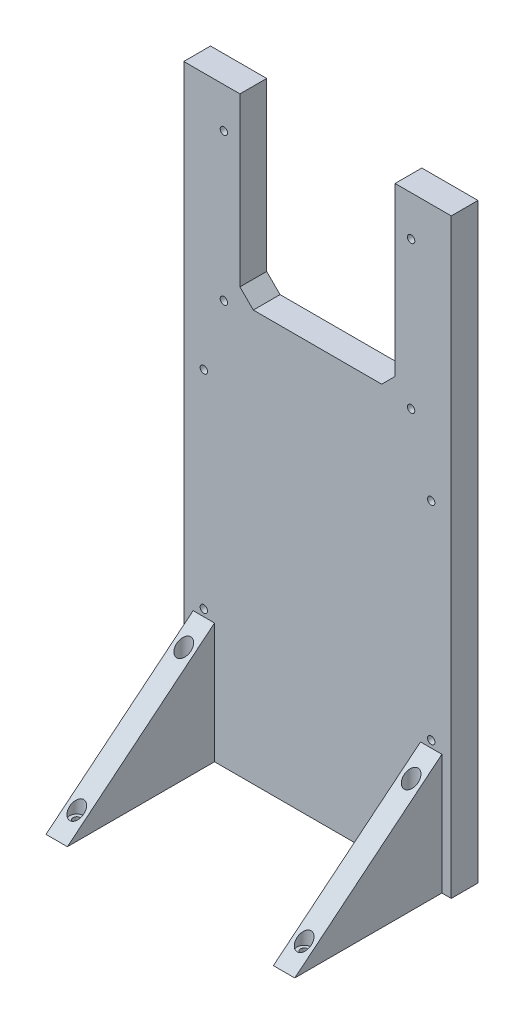
from build123d import *

# Parameters (mm, degrees)
SKETCH1_R           = 1.375
BOSS_EXTRUDE1_DEPTH = 10
CHAMFER1_SIZE       = 5
SKETCH2_W           = 8
SKETCH2_H           = 45
BOSS_EXTRUDE2_DEPTH = 55
SKETCH5_R           = 1.375
CUT_EXTRUDE2_DEPTH  = 186.151289491
SKETCH5_3_R         = 2.6
CUT_EXTRUDE3_DEPTH  = 52
SKETCH1_3_R         = 1.375
CUT_EXTRUDE4_DEPTH  = 10
CHAMFER3_SIZE       = 55.077249093
CHAMFER3_SIZE_2     = 45
SKETCH6_R           = 1.375
CUT_EXTRUDE5_DEPTH  = 10


with BuildPart() as part:
    # Sketch1 → Boss-Extrude1 (new body)
    with BuildSketch(Plane.XY):
        Polygon((-50, 110.5), (-50, -110.5), (50, -110.5), (50, 110.5), (29, 110.5), (29, 43.01), (-29, 43.01), (-29, 110.5), align=None)
        with BuildLine():
            ThreePointArc((-42.5, -64.375), (-43.875, -63), (-42.5, -61.625))
            ThreePointArc((-42.5, -61.625), (-41.125, -63), (-42.5, -64.375))
        make_face(mode=Mode.SUBTRACT)
        with Locations((42.5, -63)):
            Circle(SKETCH1_R, mode=Mode.SUBTRACT)
        with BuildLine():
            ThreePointArc((-42.5, 15.875), (-41.125, 14.5), (-42.5, 13.125))
            ThreePointArc((-42.5, 13.125), (-43.875, 14.5), (-42.5, 15.875))
        make_face(mode=Mode.SUBTRACT)
        with Locations((42.5, 14.5)):
            Circle(SKETCH1_R, mode=Mode.SUBTRACT)
    extrude(amount=BOSS_EXTRUDE1_DEPTH)

    # Chamfer1
    chamfer1_edges = [part.edges().sort_by_distance(p)[0] for p in [
        (29, 43.01, 5),
        (-29, 43.01, 5),
    ]]
    chamfer(chamfer1_edges, length=CHAMFER1_SIZE)

    # Sketch2 → Boss-Extrude2 (add)
    with BuildSketch(Plane.XY.offset(10)):
        with Locations((-42.5, -88)):
            Rectangle(SKETCH2_W, SKETCH2_H)
        with Locations((42.5, -88)):
            Rectangle(SKETCH2_W, SKETCH2_H)
    extrude(amount=BOSS_EXTRUDE2_DEPTH)

    # Sketch5 → Cut-Extrude2 (cut, through all)
    with BuildSketch(Plane(origin=(0, -55.5, 0), x_dir=(1, 0, 0), z_dir=(0, 1, 0))):
        with Locations(Location((-42.5, -17.5, 0), (0, 0, 270))):
            Circle(SKETCH5_R)
        with Locations(Location((-42.5, -57.5, 0), (0, 0, 270))):
            Circle(SKETCH5_R)
        with Locations(Location((42.5, -17.5, 0), (0, 0, 270))):
            Circle(SKETCH5_R)
        with Locations(Location((42.5, -57.5, 0), (0, 0, 270))):
            Circle(SKETCH5_R)
    extrude(amount=-CUT_EXTRUDE2_DEPTH, mode=Mode.SUBTRACT)

    # Sketch5<3> → Cut-Extrude3 (cut)
    with BuildSketch(Plane(origin=(0, -55.5, 0), x_dir=(1, 0, 0), z_dir=(0, 1, 0))):
        with Locations(Location((-42.5, -17.5, 0), (0, 0, 270))):
            Circle(SKETCH5_3_R)
        with Locations(Location((-42.5, -57.5, 0), (0, 0, 270))):
            Circle(SKETCH5_3_R)
        with Locations(Location((42.5, -17.5, 0), (0, 0, 180))):
            Circle(SKETCH5_3_R)
        with Locations(Location((42.5, -57.5, 0), (0, 0, 180))):
            Circle(SKETCH5_3_R)
    extrude(amount=-CUT_EXTRUDE3_DEPTH, mode=Mode.SUBTRACT)

    # Sketch1<3> → Cut-Extrude4 (cut)
    with BuildSketch(Plane.XY):
        with Locations((-42.5, -103)):
            Circle(SKETCH1_3_R)
        with Locations(Location((42.5, -103, 0), (0, 0, 180))):
            Circle(SKETCH1_3_R)
    extrude(amount=CUT_EXTRUDE4_DEPTH, mode=Mode.SUBTRACT)

    # Chamfer3
    # the kernel refuses this chamfer: 55.077249093, 45 mm, written as the material it takes off along each edge
    with BuildSketch(Plane(origin=(188.501029674, -65.5, 65), x_dir=(0, 0.02454043401221108, -0.9996988382000312), z_dir=(-1, 0, 0))) as chamfer3_piece_1_section:
        Polygon((CHAMFER3_SIZE * 0.9996988382, CHAMFER3_SIZE * 0.0245404340122), (-CHAMFER3_SIZE_2 * 0.0245404340122, CHAMFER3_SIZE_2 * 0.9996988382), (0, 0), align=None)
    chamfer3_piece_1 = extrude(amount=292.002059347, mode=Mode.PRIVATE)
    chamfer3_piece_1 = split(chamfer3_piece_1, bisect_by=Plane(origin=(42.5, -80.263234933, 10), z_dir=(0, 0, 1)), keep=Keep.TOP, mode=Mode.PRIVATE)
    add(chamfer3_piece_1, mode=Mode.SUBTRACT)
    with BuildSketch(Plane(origin=(103.501029674, -65.5, 65), x_dir=(0, 0.02454043401221108, -0.9996988382000312), z_dir=(-1, 0, 0))) as chamfer3_piece_2_section:
        Polygon((CHAMFER3_SIZE * 0.9996988382, CHAMFER3_SIZE * 0.0245404340122), (-CHAMFER3_SIZE_2 * 0.0245404340122, CHAMFER3_SIZE_2 * 0.9996988382), (0, 0), align=None)
    chamfer3_piece_2 = extrude(amount=292.002059347, mode=Mode.PRIVATE)
    chamfer3_piece_2 = split(chamfer3_piece_2, bisect_by=Plane(origin=(42.5, -80.263234933, 10), z_dir=(0, 0, 1)), keep=Keep.TOP, mode=Mode.PRIVATE)
    add(chamfer3_piece_2, mode=Mode.SUBTRACT)

    # Sketch6 → Cut-Extrude5 (cut)
    with BuildSketch(Plane.XY.offset(10)):
        with Locations((-35, 95.5)):
            Circle(SKETCH6_R)
        with Locations((35, 95.5)):
            Circle(SKETCH6_R)
        with Locations((35, 40.52)):
            Circle(SKETCH6_R)
        with Locations((-35, 40.52)):
            Circle(SKETCH6_R)
    extrude(amount=-CUT_EXTRUDE5_DEPTH, mode=Mode.SUBTRACT)


solid = part.part
